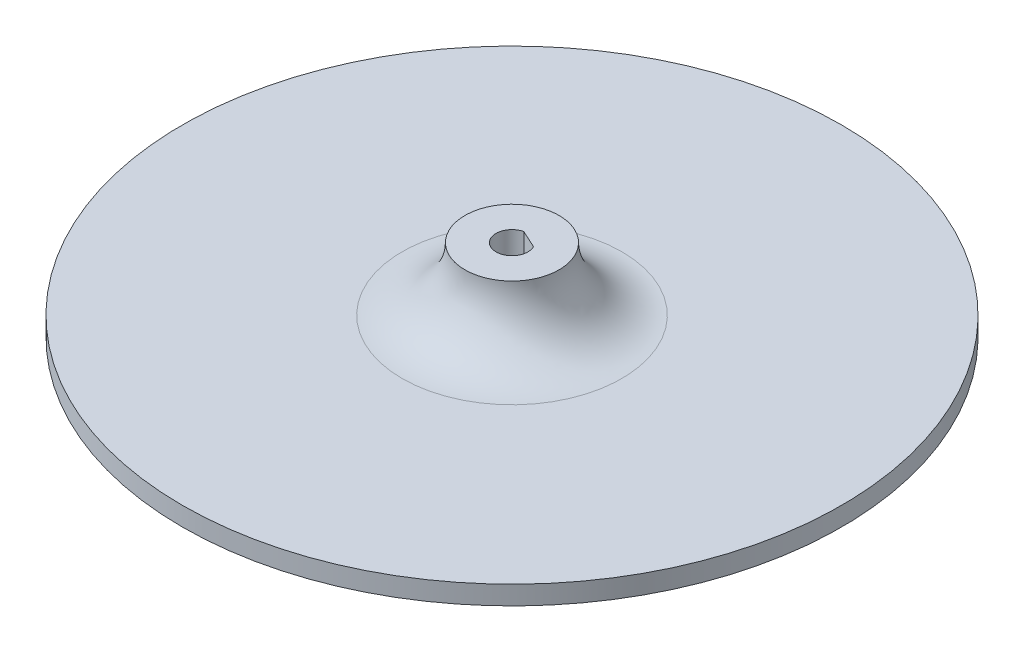
from build123d import *

# Parameters (mm, degrees)
SKIZZE1_R                       = 52.5
SKIZZE1_R_2                     = 7.5
SKIZZE1_R_3                     = 2.55
AUFSATZ_LINEAR_AUSTRAGEN1_DEPTH = 3
SKIZZE1_3_R                     = 7.5
AUFSATZ_LINEAR_AUSTRAGEN2_DEPTH = 10
VERRUNDUNG1_R                   = 10


with BuildPart() as part:
    # Skizze1 → Aufsatz-Linear austragen1 (new body)
    # profile 1 of 6: a face of its own
    with BuildSketch(Plane(origin=(0, 0, 0), x_dir=(1, 0, 0), z_dir=(0, 1, 0))):
        with Locations(Location((0, 0, 0), (0, 0, 270))):
            Circle(SKIZZE1_R)
        Circle(SKIZZE1_R_2, mode=Mode.SUBTRACT)
    # profile 2 of 6: a face of its own
    with BuildSketch(Plane(origin=(0, 0, 0), x_dir=(1, 0, 0), z_dir=(0, 1, 0))):
        Circle(SKIZZE1_R_2)
        Circle(SKIZZE1_R_3, mode=Mode.SUBTRACT)
    # profile 3 of 6: a face of its own
    with BuildSketch(Plane(origin=(0, 0, 0), x_dir=(1, 0, 0), z_dir=(0, 1, 0))):
        with BuildLine():
            Line((2.272895339, 1.156047913), (-0.601535262, 2.47803457))
            ThreePointArc((-0.601535262, 2.47803457), (-1.576163869, -2.004546697), (2.55, 0))
            ThreePointArc((2.55, 0), (2.47975635, 0.594397546), (2.272895339, 1.156047913))
        make_face()
    # profile 4 of 6: a face of its own
    with BuildSketch(Plane(origin=(0, 0, 0), x_dir=(1, 0, 0), z_dir=(0, 1, 0))):
        with BuildLine():
            ThreePointArc((2.272895339, 1.156047913), (1.065492049, 2.316727583), (-0.601535262, 2.47803457))
            Line((-0.601535262, 2.47803457), (2.272895339, 1.156047913))
        make_face()
    # profile 5 of 6: a face of its own
    with BuildSketch(Plane(origin=(0, 0, 0), x_dir=(1, 0, 0), z_dir=(0, 1, 0))):
        with BuildLine():
            Line((2.272895339, 1.156047913), (-0.601535262, 2.47803457))
            ThreePointArc((-0.601535262, 2.47803457), (-1.576163869, -2.004546697), (2.55, 0))
            ThreePointArc((2.55, 0), (2.47975635, 0.594397546), (2.272895339, 1.156047913))
        make_face()
    # profile 6 of 6: a face of its own
    with BuildSketch(Plane(origin=(0, 0, 0), x_dir=(1, 0, 0), z_dir=(0, 1, 0))):
        with BuildLine():
            ThreePointArc((2.272895339, 1.156047913), (1.065492049, 2.316727583), (-0.601535262, 2.47803457))
            Line((-0.601535262, 2.47803457), (2.272895339, 1.156047913))
        make_face()
    extrude(amount=-AUFSATZ_LINEAR_AUSTRAGEN1_DEPTH)

    # Skizze1<3> → Aufsatz-Linear austragen2 (add)
    with BuildSketch(Plane(origin=(0, 0, 0), x_dir=(1, 0, 0), z_dir=(0, 1, 0))):
        with Locations(Location((0, 0, 0), (0, 0, 270))):
            Circle(SKIZZE1_3_R)
        with BuildLine():
            Line((-0.601535262, 2.47803457), (2.272895339, 1.156047913))
            ThreePointArc((2.272895339, 1.156047913), (-1.065492049, -2.316727583), (-0.601535262, 2.47803457))
        make_face(mode=Mode.SUBTRACT)
    extrude(amount=AUFSATZ_LINEAR_AUSTRAGEN2_DEPTH)

    # Verrundung1
    verrundung1_edges = [part.edges().sort_by_distance(p)[0] for p in [
        (0, 0, -7.5),
    ]]
    fillet(verrundung1_edges, radius=VERRUNDUNG1_R - 0.0001)  # a hair under: the kernel refuses the full size


solid = part.part
